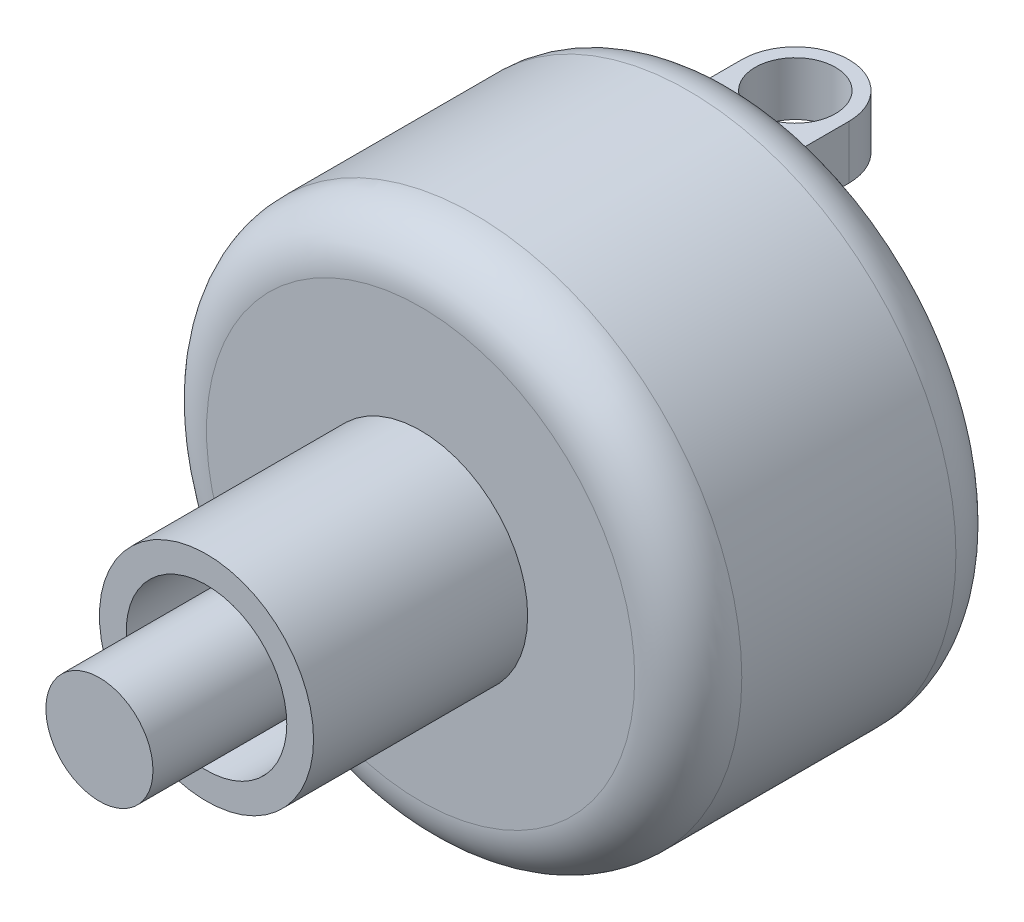
from build123d import *

# Parameters (mm, degrees)
SKETCH1_R           = 25
BOSS_EXTRUDE1_DEPTH = 30
SKETCH2_R           = 10
BOSS_EXTRUDE2_DEPTH = 20
SKETCH3_R           = 7.5
CUT_EXTRUDE1_DEPTH  = 20
SKETCH4_R           = 5
BOSS_EXTRUDE3_DEPTH = 30
SKETCH5_R           = 7.5
BOSS_EXTRUDE4_DEPTH = 5
SKETCH7_W           = 10
SKETCH7_H           = 5
BOSS_EXTRUDE5_DEPTH = 10
SKETCH8_R           = 3.75
CUT_EXTRUDE2_DEPTH  = 5
CUT_EXTRUDE3_START  = -5
SKETCH9_R           = 3.75
CUT_EXTRUDE3_DEPTH  = 5
FILLET1_R           = 5
FILLET2_R           = 5
FILLET3_R           = 1


# Some blends are built 0.0001 mm under size
with BuildPart() as part:
    # Sketch1 → Boss-Extrude1 (new body)
    with BuildSketch(Plane.XY):
        Circle(SKETCH1_R)
    extrude(amount=BOSS_EXTRUDE1_DEPTH)

    # Sketch2 → Boss-Extrude2 (add)
    with BuildSketch(Plane.XY.offset(30)):
        Circle(SKETCH2_R)
    extrude(amount=BOSS_EXTRUDE2_DEPTH)

    # Sketch3 → Cut-Extrude1 (cut)
    with BuildSketch(Plane.XY.offset(50)):
        Circle(SKETCH3_R)
    extrude(amount=-CUT_EXTRUDE1_DEPTH, mode=Mode.SUBTRACT)

    # Sketch4 → Boss-Extrude3 (add)
    with BuildSketch(Plane.XY.offset(30)):
        Circle(SKETCH4_R)
    extrude(amount=BOSS_EXTRUDE3_DEPTH)

    # Sketch5 → Boss-Extrude4 (add)
    with BuildSketch(Plane(origin=(0, 0, 0), x_dir=(-1, 0, 0), z_dir=(0, 0, -1))):
        with Locations(Location((0, 0, 0), (0, 0, 180))):
            Circle(SKETCH5_R)
    extrude(amount=BOSS_EXTRUDE4_DEPTH)

    # Sketch7 → Boss-Extrude5 (add)
    with BuildSketch(Plane(origin=(0, 0, 0), x_dir=(-1, 0, 0), z_dir=(0, 0, -1))):
        with Locations((0, 17.5)):
            Rectangle(SKETCH7_W, SKETCH7_H)
        with Locations((0, -17.5)):
            Rectangle(SKETCH7_W, SKETCH7_H)
    extrude(amount=BOSS_EXTRUDE5_DEPTH)

    # Sketch8 → Cut-Extrude2 (cut)
    with BuildSketch(Plane(origin=(0, 20, 0), x_dir=(1, 0, 0), z_dir=(0, 1, 0))):
        with Locations(Location((0, 5, 0), (0, 0, 180))):
            Circle(SKETCH8_R)
    extrude(amount=-CUT_EXTRUDE2_DEPTH, mode=Mode.SUBTRACT)

    # Sketch9 → Cut-Extrude3 (cut)
    with BuildSketch(Plane(origin=(0, -20, 0), x_dir=(-1, 0, 0), z_dir=(0, -1, 0)).offset(CUT_EXTRUDE3_START)):
        with Locations((0, 5)):
            Circle(SKETCH9_R)
    extrude(amount=CUT_EXTRUDE3_DEPTH, mode=Mode.SUBTRACT)

    # Fillet1
    # the kernel refuses this fillet: 5 mm, written as the material it takes off along each edge
    with BuildSketch(Plane(origin=(0, 0, 30), x_dir=(1, 0, 0), z_dir=(0, -1, 0))) as fillet1_piece_1:
        with BuildLine():
            CenterArc((25 - FILLET1_R, -FILLET1_R), FILLET1_R, 0, 90)
            Line((25 - FILLET1_R, 0), (25, 0))
            Line((25, 0), (25, -FILLET1_R))
        make_face()
    revolve(axis=Axis((0, 0, 30), (0, 0, 1)), mode=Mode.SUBTRACT)
    with BuildSketch(Plane(origin=(0, 0, 0), x_dir=(1, 0, 0), z_dir=(0, -1, 0))) as fillet1_piece_2_section:
        with BuildLine():
            CenterArc((25 - FILLET1_R, FILLET1_R), FILLET1_R, 270, 90)
            Line((25 - FILLET1_R, 0), (25, 0))
            Line((25, 0), (25, FILLET1_R))
        make_face()
    fillet1_piece_2 = revolve(axis=Axis((0, 0, 0), (0, 0, 1)), mode=Mode.PRIVATE)
    fillet1_piece_2 = split(fillet1_piece_2, bisect_by=Plane(origin=(5, 14.511659558, 1.419610571), z_dir=(1, 0, 0)), keep=Keep.TOP, mode=Mode.PRIVATE)
    add(fillet1_piece_2, mode=Mode.SUBTRACT)
    with BuildSketch(Plane(origin=(0, 0, 0), x_dir=(1, 0, 0), z_dir=(0, -1, 0))) as fillet1_piece_3_section:
        with BuildLine():
            CenterArc((25 - FILLET1_R, FILLET1_R), FILLET1_R, 270, 90)
            Line((25 - FILLET1_R, 0), (25, 0))
            Line((25, 0), (25, FILLET1_R))
        make_face()
    fillet1_piece_3 = revolve(axis=Axis((0, 0, 0), (0, 0, 1)), mode=Mode.PRIVATE)
    fillet1_piece_3 = split(fillet1_piece_3, bisect_by=Plane(origin=(4.6e-08, 20, 1.116734198), z_dir=(0, 1, 0)), keep=Keep.TOP, mode=Mode.PRIVATE)
    add(fillet1_piece_3, mode=Mode.SUBTRACT)
    with BuildSketch(Plane(origin=(0, 0, 0), x_dir=(1, 0, 0), z_dir=(0, -1, 0))) as fillet1_piece_4_section:
        with BuildLine():
            CenterArc((25 - FILLET1_R, FILLET1_R), FILLET1_R, 270, 90)
            Line((25 - FILLET1_R, 0), (25, 0))
            Line((25, 0), (25, FILLET1_R))
        make_face()
    fillet1_piece_4 = revolve(axis=Axis((0, 0, 0), (0, 0, 1)), mode=Mode.PRIVATE)
    fillet1_piece_4 = split(fillet1_piece_4, bisect_by=Plane(origin=(-4.6e-08, -20, 1.116734198), z_dir=(0, -1, 0)), keep=Keep.TOP, mode=Mode.PRIVATE)
    add(fillet1_piece_4, mode=Mode.SUBTRACT)
    with BuildSketch(Plane(origin=(0, 0, 0), x_dir=(1, 0, 0), z_dir=(0, -1, 0))) as fillet1_piece_5_section:
        with BuildLine():
            CenterArc((25 - FILLET1_R, FILLET1_R), FILLET1_R, 270, 90)
            Line((25 - FILLET1_R, 0), (25, 0))
            Line((25, 0), (25, FILLET1_R))
        make_face()
    fillet1_piece_5 = revolve(axis=Axis((0, 0, 0), (0, 0, 1)), mode=Mode.PRIVATE)
    fillet1_piece_5 = split(fillet1_piece_5, bisect_by=Plane(origin=(-5, 0, 1.419610538), z_dir=(-1, 0, 0)), keep=Keep.TOP, mode=Mode.PRIVATE)
    add(fillet1_piece_5, mode=Mode.SUBTRACT)

    # Fillet2
    fillet2_edges = [part.edges().sort_by_distance(p)[0] for p in [
        (5, -17.5, -10),
        (-5, -17.5, -10),
        (5, 17.5, -10),
        (-5, 17.5, -10),
    ]]
    fillet(fillet2_edges, radius=FILLET2_R - 0.0001)  # a hair under: the kernel refuses the full size

    # Fillet3
    fillet3_edges = [part.edges().sort_by_distance(p)[0] for p in [
        (-7.5, 0, 0),
        (-7.5, 0, -5),
    ]]
    fillet(fillet3_edges, radius=FILLET3_R)


solid = part.part
